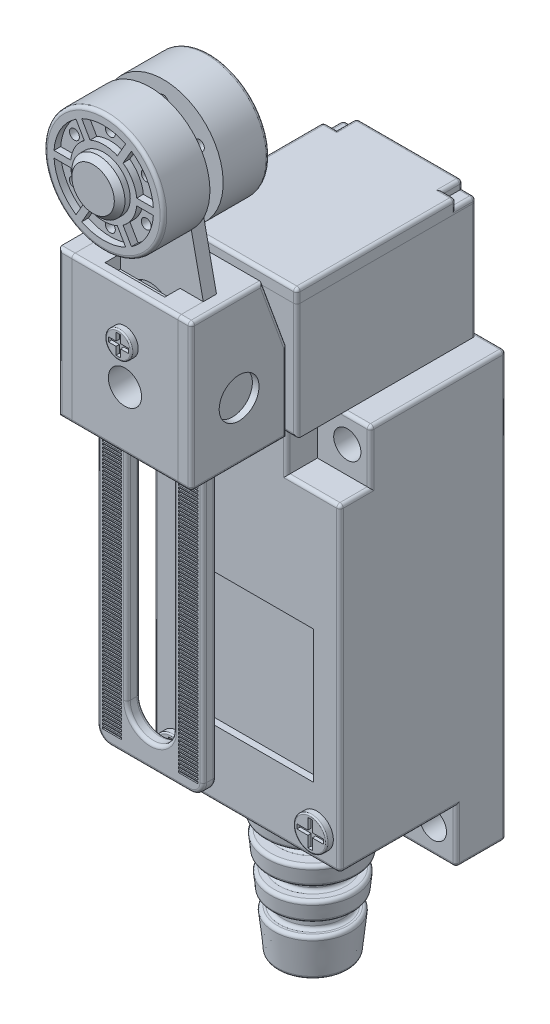
from build123d import *

# Parameters (mm, degrees)
EXTRUDE_1_DEPTH          = 12.5
SKETCH_2_W               = 17.5
SKETCH_2_H               = 8
CUT_EXTRUDE_1_DEPTH      = 67.936537108
SKETCH_3_W               = 4.6
SKETCH_3_H               = 8
CUT_EXTRUDE_2_DEPTH      = 8
SKETCH_4_R               = 2.05
CUT_EXTRUDE_3_DEPTH      = 65.439196146
SKETCH_5_R               = 7.55
EXTRUDE_3_DEPTH          = 22
EXTRUDE_3_TAPER          = 6
SKETCH_6_W               = 3
SKETCH_6_H               = 2
SKETCH_6_W_2             = 2
SKETCH_7_R               = 2.5
EXTRUDE_4_DEPTH          = 1
CUT_EXTRUDE_4_DEPTH      = 0.5
FILLET_1_R               = 0.5
FILLET_3_R               = 0.5
SKETCH_9_W               = 20
SKETCH_9_H               = 20
CUT_EXTRUDE_5_DEPTH      = 1
SKETCH_10_W              = 27
SKETCH_10_H              = 19.5
EXTRUDE_5_DEPTH          = 10
SKETCH_11_R              = 3
EXTRUDE_6_DEPTH          = 15.9
EXTRUDE_7_DEPTH          = 43
EXTRUDE_7_DEPTH_BACK     = 43
SKETCH_12_W              = 16
SKETCH_12_H              = 2
CUT_EXTRUDE_6_DEPTH      = 2
SKETCH_16_W              = 9
SKETCH_16_H              = 2.3
CUT_EXTRUDE_7_DEPTH      = 2
SKETCH_17_R              = 9
EXTRUDE_8_DEPTH          = 7
SKETCH_18_R              = 7.5
SKETCH_18_R_2            = 5
CUT_EXTRUDE_8_DEPTH      = 1
SKETCH_19_R              = 0.75
CUT_EXTRUDE_11_DEPTH     = 6
SKETCH_20_W              = 3.5
SKETCH_20_H              = 1
EXTRUDE_9_DEPTH          = 1
PATTERN_CIRCULAR_1_COUNT = 6
SKETCH_26_R              = 0.75
CUT_EXTRUDE_15_DEPTH     = 6
SKETCH_27_W              = 3.5
SKETCH_27_H              = 1
EXTRUDE_12_DEPTH         = 1
PATTERN_CIRCULAR_3_COUNT = 6
EXTRUDE_10_DEPTH         = 1.6
EXTRUDE_10_DEPTH_BACK    = 17.6
SKETCH_21_R              = 4
SKETCH_22_R              = 2.5
CUT_EXTRUDE_12_DEPTH     = 3.8
SKETCH_23_R              = 2
EXTRUDE_11_DEPTH         = 1
CUT_EXTRUDE_13_DEPTH     = 0.5
SKETCH_25_R              = 3
CUT_EXTRUDE_14_DEPTH     = 1
SKETCH_30_W              = 3
SKETCH_30_H              = 1.25
CUT_EXTRUDE_16_DEPTH     = 2
FILLET_5_R               = 0.5
FILLET_6_R               = 2
FILLET_7_R               = 0.2
CHAMFER_1_SIZE           = 0.8
SKETCH_31_W              = 2.9
SKETCH_31_H              = 0.3
CUT_EXTRUDE_17_DEPTH     = 0.2
PATTERN_LINEAR_1_COUNT   = 82
PATTERN_LINEAR_1_PITCH   = 0.5


with BuildPart() as part:
    # 草图1 → 凸台-拉伸1 (new, symmetric)
    with BuildSketch(Plane.XY):
        Polygon((10, 4.5), (14, 4.5), (14, -59.5), (-14, -59.5), (-14, 4.5), (-10, 4.5), align=None)
    extrude(amount=EXTRUDE_1_DEPTH, both=True)

    # 草图2 → 切除-拉伸1 (cut, through all)
    with BuildSketch(Plane(origin=(14, 0, 0), x_dir=(0, 0, -1), z_dir=(1, 0, 0))):
        with Locations((-3.75, -55.5)):
            Rectangle(SKETCH_2_W, SKETCH_2_H)
    extrude(amount=-CUT_EXTRUDE_1_DEPTH, mode=Mode.SUBTRACT)

    # 草图3 → 切除-拉伸2 (cut)
    with BuildSketch(Plane(origin=(14, 0, 0), x_dir=(0, 0, -1), z_dir=(1, 0, 0))):
        with Locations((-10.2, 0.5)):
            Rectangle(SKETCH_3_W, SKETCH_3_H)
    cut_extrude_2 = extrude(amount=-CUT_EXTRUDE_2_DEPTH, mode=Mode.SUBTRACT)

    # 镜向1: 切除-拉伸2 across plane
    add(cut_extrude_2.mirror(Plane(origin=(0, 0, 0), x_dir=(0, 0, 1), z_dir=(1, 0, 0))), mode=Mode.SUBTRACT)

    # 草图4 → 切除-拉伸3 (cut, through all)
    with BuildSketch(Plane.XY.offset(7.9)):
        with Locations((-10.5, 0.531373033)):
            Circle(SKETCH_4_R)
        with Locations((-10.5, -55.468626967)):
            Circle(SKETCH_4_R)
    cut_extrude_3 = extrude(amount=-CUT_EXTRUDE_3_DEPTH, mode=Mode.SUBTRACT)

    # 镜向2: 切除-拉伸3 across plane
    add(cut_extrude_3.mirror(Plane(origin=(0, 0, 0), x_dir=(0, 0, 1), z_dir=(1, 0, 0))), mode=Mode.SUBTRACT)

    # 草图5 → 凸台-拉伸3 (add)
    with BuildSketch(Plane.XZ.offset(51.5)):
        with Locations((0, 2.6)):
            Circle(SKETCH_5_R)
    extrude(amount=EXTRUDE_3_DEPTH, taper=EXTRUDE_3_TAPER)

    # 草图6 → 切除-旋转1 (revolve, cut)
    with BuildSketch(Plane(origin=(0, 0, 2.6), x_dir=(-1, 0, 0), z_dir=(0, 0, -1)), mode=Mode.PRIVATE) as cut_revolve_1_sk:
        with Locations((-6, -56.5)):
            Rectangle(SKETCH_6_W, SKETCH_6_H)
        with Locations((-6, -61.5)):
            Rectangle(SKETCH_6_W, SKETCH_6_H)
        with Locations((-5.5, -66.5)):
            Rectangle(SKETCH_6_W_2, SKETCH_6_H)
    revolve(cut_revolve_1_sk.sketch.rotate(Axis((0, -51.5, 2.6), (0, -1, 0)), 180), axis=Axis((0, -51.5, 2.6), (0, -1, 0)), mode=Mode.SUBTRACT)

    # 草图7 → 凸台-拉伸4 (add)
    with BuildSketch(Plane.XY.offset(12.5)):
        with Locations(Location((-10.5, -47.5, 0), (0, 0, 180))):
            Circle(SKETCH_7_R)
        with Locations(Location((10.5, -47.5, 0), (0, 0, 180))):
            Circle(SKETCH_7_R)
        with Locations(Location((0, 0.5, 0), (0, 0, 180))):
            Circle(SKETCH_7_R)
    extrude(amount=EXTRUDE_4_DEPTH)

    # 草图8 → 切除-拉伸4 (cut)
    with BuildSketch(Plane.XY.offset(13.5)):
        Polygon((-2, 0.84), (-2, 0.16), (-0.325, 0.16), (-0.325, -1.5), (0.325, -1.5), (0.325, 0.16), (2, 0.16), (2, 0.84), (0.325, 0.84), (0.325, 2.5), (-0.325, 2.5), (-0.325, 0.84), align=None)
        Polygon((-12.5, -47.16), (-12.5, -47.84), (-10.84, -47.84), (-10.84, -49.5), (-10.16, -49.5), (-10.16, -47.84), (-8.5, -47.84), (-8.5, -47.16), (-10.16, -47.16), (-10.16, -45.5), (-10.84, -45.5), (-10.84, -47.16), align=None)
        Polygon((10.84, -47.84), (12.5, -47.84), (12.5, -47.16), (10.84, -47.16), (10.84, -45.5), (10.16, -45.5), (10.16, -47.16), (8.5, -47.16), (8.5, -47.84), (10.16, -47.84), (10.16, -49.5), (10.84, -49.5), align=None)
    extrude(amount=-CUT_EXTRUDE_4_DEPTH, mode=Mode.SUBTRACT)

    # 圆角1
    fillet_1_edges = [part.edges().sort_by_distance(p)[0] for p in [
        (14, -27.5, 12.5),
        (14, -59.5, -8.75),
        (-14, -59.5, -8.75),
        (0, -59.5, -5),
        (-14, -51.5, 3.75),
        (0, -51.5, 12.5),
        (-14, -55.5, -5),
        (14, -55.5, -5),
        (14, -51.5, 3.75),
        (0, 4.5, 12.5),
        (14, 4.5, -2.3),
        (6, 0.5, 12.5),
        (10, -3.5, 12.5),
        (6, 4.5, 10.2),
        (10, 4.5, 7.9),
        (14, -3.5, 10.2),
        (14, 0.5, 7.9),
        (-14, -27.5, 12.5),
        (-14, 4.5, -2.3),
        (-14, -3.5, 10.2),
        (-10, -3.5, 12.5),
        (-14, 0.5, 7.9),
        (-10, 4.5, 7.9),
        (-6, 0.5, 12.5),
        (-6, 4.5, 10.2),
        (0, 4.5, -12.5),
        (14, -27.5, -12.5),
        (0, -59.5, -12.5),
        (-14, -27.5, -12.5),
    ]]
    fillet(fillet_1_edges, radius=FILLET_1_R)

    # 圆角3
    fillet_3_edges = [part.edges().sort_by_distance(p)[0] for p in [
        (-5.237706824, -73.5, 2.6),
        (4.5, -57.5, 2.6),
        (-6.919374588, -57.5, 2.6),
        (-7.129583059, -55.5, 2.6),
        (4.5, -55.5, 2.6),
        (4.5, -62.5, 2.6),
        (-6.393853412, -62.5, 2.6),
        (-6.604061883, -60.5, 2.6),
        (4.5, -60.5, 2.6),
        (4.5, -67.5, 2.6),
        (-5.868332236, -67.5, 2.6),
        (-6.078540706, -65.5, 2.6),
        (4.5, -65.5, 2.6),
    ]]
    fillet(fillet_3_edges, radius=FILLET_3_R)

    # 草图9 → 切除-拉伸5 (cut)
    with BuildSketch(Plane.XY.offset(12.5)):
        with Locations((0, -31.5)):
            Rectangle(SKETCH_9_W, SKETCH_9_H)
    extrude(amount=-CUT_EXTRUDE_5_DEPTH, mode=Mode.SUBTRACT)

    # 草图10 → 凸台-拉伸5 (add, symmetric)
    with BuildSketch(Plane(origin=(0, 0, 0), x_dir=(0, 0, -1), z_dir=(1, 0, 0))):
        with Locations((-1.5, 14.25)):
            Rectangle(SKETCH_10_W, SKETCH_10_H)
        Polygon((-16.5, 5.5), (-30.9, 5.5), (-30.9, 27.5), (-20.139702343, 27.5), (-16.5, 17.5), align=None)
    extrude(amount=EXTRUDE_5_DEPTH, both=True)


with BuildPart() as extrude_5_piece_1:
    # of the separate pieces the step leaves, piece 1, a body of its own (extrude_5_pieces)
    add(part.part.solids().sort_by_distance((7.176641984, -55.052264232, 2.6))[0])



with BuildPart() as extrude_5_piece_2:
    # of the separate pieces the step leaves, piece 2, a body of its own (extrude_5_pieces)
    add(part.part.solids().sort_by_distance((-10, 5.5, 16.5))[0])


with BuildPart() as extrude_5_piece_1_1:
    add(extrude_5_piece_1.part)

    add(extrude_5_piece_2.part)  # 凸台-拉伸6 merges 凸台-拉伸5 piece 2
    # 草图11 → 凸台-拉伸6 (add)
    with BuildSketch(Plane.XY.offset(30.9)):
        with Locations((0, 14.25)):
            Circle(SKETCH_11_R)
    extrude(amount=-EXTRUDE_6_DEPTH)

    # 草图12 → 凸台-拉伸7 (add, two sides: drawn at the far end of the back side and taken through both)
    with BuildSketch(Plane.XZ.offset(-5.5).offset(-EXTRUDE_7_DEPTH_BACK)):
        with Locations((0, 26.1)):
            Rectangle(SKETCH_12_W, SKETCH_12_H)
    extrude(amount=EXTRUDE_7_DEPTH + EXTRUDE_7_DEPTH_BACK)

    # 草图13 → 切除-拉伸6 (cut)
    with BuildSketch(Plane.XY.offset(27.1)):
        with BuildLine():
            Line((3.5, 22.5), (3.5, -30.5))
            ThreePointArc((3.5, -30.5), (0, -34), (-3.5, -30.5))
            Line((-3.5, -30.5), (-3.5, 22.5))
            ThreePointArc((-3.5, 22.5), (0, 26), (3.5, 22.5))
        make_face()
        with BuildLine():
            Line((-8, 27.5), (-4.528302411, 43.83305301))
            ThreePointArc((-4.528302411, 43.83305301), (0, 47.5), (4.528302411, 43.83305301))
            Line((4.528302411, 43.83305301), (8, 27.5))
            Line((8, 27.5), (8, 48.5))
            Line((8, 48.5), (-8, 48.5))
            Line((-8, 48.5), (-8, 27.5))
        make_face()
    extrude(amount=-CUT_EXTRUDE_6_DEPTH, mode=Mode.SUBTRACT)

    # 草图16 → 切除-拉伸7 (cut)
    with BuildSketch(Plane.XZ.offset(-5.5)):
        with Locations((0, 28.25)):
            Rectangle(SKETCH_16_W, SKETCH_16_H)
    cut_extrude_7 = extrude(amount=-CUT_EXTRUDE_7_DEPTH, mode=Mode.SUBTRACT)

    # 草图17 → 凸台-拉伸8 (add)
    with BuildSketch(Plane.XY.offset(27.1)):
        with Locations(Location((0, 42.5, 0), (0, 0, 226.469992278))):
            Circle(SKETCH_17_R)
    extrude_8 = extrude(amount=EXTRUDE_8_DEPTH)

    # 镜向4: 切除-拉伸7 across plane
    add(cut_extrude_7.mirror(Plane.ZX.offset(16.5)), mode=Mode.SUBTRACT)

    # 草图18 → 切除-拉伸8 (cut)
    with BuildSketch(Plane.XY.offset(34.1)):
        with Locations((0, 42.5)):
            Circle(SKETCH_18_R)
        with Locations((0, 42.5)):
            Circle(SKETCH_18_R_2, mode=Mode.SUBTRACT)
    cut_extrude_8 = extrude(amount=-CUT_EXTRUDE_8_DEPTH, mode=Mode.SUBTRACT)

    # 草图19 → 切除-拉伸11 (cut)
    with BuildSketch(Plane.XY.offset(33.1)):
        with Locations((0, 48.75)):
            Circle(SKETCH_19_R)
    cut_extrude_11 = extrude(amount=-CUT_EXTRUDE_11_DEPTH, mode=Mode.SUBTRACT)

    # 草图20 → 凸台-拉伸9 (add)
    with BuildSketch(Plane.XY.offset(33.1)):
        with Locations((6.25, 42.5)):
            Rectangle(SKETCH_20_W, SKETCH_20_H)
    extrude_9 = extrude(amount=EXTRUDE_9_DEPTH)

    # 阵列(圆周)1: 切除-拉伸11, 凸台-拉伸9 ×6 about axis
    pattern_circular_1_axis = Axis((0, 42.5, 0), (0, 0, 1))
    add([cut_extrude_11.rotate(pattern_circular_1_axis, i * 360 / PATTERN_CIRCULAR_1_COUNT) for i in range(1, PATTERN_CIRCULAR_1_COUNT)], mode=Mode.SUBTRACT)
    add([extrude_9.rotate(pattern_circular_1_axis, i * 360 / PATTERN_CIRCULAR_1_COUNT) for i in range(1, PATTERN_CIRCULAR_1_COUNT)])

    # 镜向6: 凸台-拉伸8, 切除-拉伸8 across plane
    add(extrude_8.mirror(Plane(origin=(0, 0, 26.1), x_dir=(1, 0, 0), z_dir=(0, 0, -1))))
    add(cut_extrude_8.mirror(Plane(origin=(0, 0, 26.1), x_dir=(1, 0, 0), z_dir=(0, 0, -1))), mode=Mode.SUBTRACT)

    # 草图26 → 切除-拉伸15 (cut)
    with BuildSketch(Plane(origin=(0, 0, 19.1), x_dir=(-1, 0, 0), z_dir=(0, 0, -1))):
        with Locations(Location((0, 48.75, 0), (0, 0, 180))):
            Circle(SKETCH_26_R)
    cut_extrude_15 = extrude(amount=-CUT_EXTRUDE_15_DEPTH, mode=Mode.SUBTRACT)

    # 草图27 → 凸台-拉伸12 (add)
    with BuildSketch(Plane(origin=(0, 0, 19.1), x_dir=(-1, 0, 0), z_dir=(0, 0, -1))):
        with Locations((6.25, 42.5)):
            Rectangle(SKETCH_27_W, SKETCH_27_H)
    extrude_12 = extrude(amount=EXTRUDE_12_DEPTH)

    # 阵列(圆周)3: 切除-拉伸15, 凸台-拉伸12 ×6 about axis
    pattern_circular_3_axis = Axis((0, 42.5, 0), (0, 0, 1))
    add([cut_extrude_15.rotate(pattern_circular_3_axis, i * 360 / PATTERN_CIRCULAR_3_COUNT) for i in range(1, PATTERN_CIRCULAR_3_COUNT)], mode=Mode.SUBTRACT)
    add([extrude_12.rotate(pattern_circular_3_axis, i * 360 / PATTERN_CIRCULAR_3_COUNT) for i in range(1, PATTERN_CIRCULAR_3_COUNT)])

    # 草图21 → 凸台-拉伸10 (add, two sides: drawn at the far end of the back side and taken through both)
    with BuildSketch(Plane.XY.offset(34.1).offset(-EXTRUDE_10_DEPTH_BACK)):
        with Locations(Location((0, 42.5, 0), (0, 0, 180))):
            Circle(SKETCH_21_R)
    extrude(amount=EXTRUDE_10_DEPTH + EXTRUDE_10_DEPTH_BACK)

    # 草图22 → 切除-拉伸12 (cut)
    with BuildSketch(Plane.XY.offset(30.9)):
        with Locations((0, 14.25)):
            Circle(SKETCH_22_R)
    extrude(amount=-CUT_EXTRUDE_12_DEPTH, mode=Mode.SUBTRACT)

    # 草图23 → 凸台-拉伸11 (add)
    with BuildSketch(Plane.XY.offset(30.9)):
        with Locations((0, 20.25)):
            Circle(SKETCH_23_R)
    extrude(amount=EXTRUDE_11_DEPTH)

    # 草图24 → 切除-拉伸13 (cut)
    with BuildSketch(Plane.XY.offset(31.9)):
        Polygon((0.34, 20.59), (1.5, 20.59), (1.5, 19.91), (0.34, 19.91), (0.34, 18.75), (-0.34, 18.75), (-0.34, 19.91), (-1.5, 19.91), (-1.5, 20.59), (-0.34, 20.59), (-0.34, 21.75), (0.34, 21.75), align=None)
    extrude(amount=-CUT_EXTRUDE_13_DEPTH, mode=Mode.SUBTRACT)

    # 草图25 → 切除-拉伸14 (cut)
    with BuildSketch(Plane(origin=(10, 0, 0), x_dir=(0, 0, -1), z_dir=(1, 0, 0))):
        with Locations((-23.7, 14.25)):
            Circle(SKETCH_25_R)
    extrude(amount=-CUT_EXTRUDE_14_DEPTH, mode=Mode.SUBTRACT)

    # 草图30 → 切除-拉伸16 (cut)
    with BuildSketch(Plane(origin=(10, 0, 0), x_dir=(0, 0, -1), z_dir=(1, 0, 0))):
        with Locations((10.5, 23.375)):
            Rectangle(SKETCH_30_W, SKETCH_30_H)
    cut_extrude_16 = extrude(amount=-CUT_EXTRUDE_16_DEPTH, mode=Mode.SUBTRACT)

    # 镜向7: 切除-拉伸16 across plane
    add(cut_extrude_16.mirror(Plane(origin=(0, 0, 0), x_dir=(0, 0, 1), z_dir=(1, 0, 0))), mode=Mode.SUBTRACT)

    # 圆角5
    fillet_5_edges = [extrude_5_piece_1_1.edges().sort_by_distance(p)[0] for p in [
        (-10, 13.625, -12),
        (-10, 14.25, 15),
        (0, 24, 15),
        (0, 4.5, 15),
        (10, 13.625, -12),
        (10, 14.25, 15),
        (-10, 11.5, 16.5),
        (-10, 22.5, 18.319851171),
        (-10, 16.5, 30.9),
        (0, 27.5, 30.9),
        (0, 5.5, 30.9),
        (10, 11.5, 16.5),
        (10, 22.5, 18.319851171),
        (10, 27.5, 25.519851171),
        (10, 16.5, 30.9),
        (10, 5.5, 23.7),
        (-8, -16, 27.1),
        (-8, -16, 25.1),
        (8, -16, 25.1),
        (8, -16, 27.1),
        (0, -37.5, 25.1),
        (0, -37.5, 27.1),
        (3.5, -12.5, 25.1),
        (3.5, -11.5, 27.1),
        (-3.5, -11.5, 27.1),
        (0, -34, 27.1),
        (-3.5, -12.5, 25.1),
        (0, -34, 25.1),
        (0, 5.5, 30.9),
        (0, 27.5, 30.9),
        (0, 5.5, 30.9),
        (0, 27.5, 30.9),
        (-4.5, 6.5, 29.4),
        (4.5, 6.5, 29.4),
        (-4.5, 5.5, 28.25),
        (4.5, 5.5, 28.25),
        (0, 5.5, 29.4),
        (6.198609457, 49.025123814, 34.1),
        (6.198609457, 49.025123814, 18.1),
        (10, 13.625, -12),
        (10, 14.25, 15),
        (-10, 13.625, -12),
        (-10, 14.25, 15),
        (10, 24, 3),
        (0, 24, -12),
        (8, 23.375, -12),
        (9, 22.75, -12),
        (8, 24, -10.5),
        (9, 24, -9),
        (10, 23.375, -9),
        (10, 22.75, -10.5),
        (-10, 24, 3),
        (-9, 22.75, -12),
        (-10, 23.375, -9),
        (-9, 24, -9),
        (-10, 22.75, -10.5),
        (-8, 23.375, -12),
        (-8, 24, -10.5),
    ]]
    fillet(fillet_5_edges, radius=FILLET_5_R)

    # 圆角6
    # the kernel refuses this fillet: 2 mm, written as the material it takes off along each edge
    with BuildSketch(Plane(origin=(-6, -35.5, 27.1), x_dir=(-1, 0, 0), z_dir=(0, 1, 0))) as fillet_6_piece_1:
        with BuildLine():
            CenterArc((1.5, -0.5), 0.5, 0, 90)
            Line((2, -0.5), (2, 0))
            Line((2, 0), (1.5, 0))
        make_face()
    revolve(axis=Axis((-6, -35.5, 27.1), (0, 0, 1)), revolution_arc=90, mode=Mode.SUBTRACT)
    with BuildSketch(Plane(origin=(6, -35.5, 27.1), x_dir=(0, -1, 0), z_dir=(-1, 0, 0))) as fillet_6_piece_2:
        with BuildLine():
            CenterArc((1.5, -0.5), 0.5, 0, 90)
            Line((2, -0.5), (2, 0))
            Line((2, 0), (1.5, 0))
        make_face()
    revolve(axis=Axis((6, -35.5, 27.1), (0, 0, 1)), revolution_arc=90, mode=Mode.SUBTRACT)
    with BuildSketch(Plane(origin=(-6, -35.5, 25.1), x_dir=(0, -1, 0), z_dir=(1, 0, 0))) as fillet_6_piece_3:
        with BuildLine():
            CenterArc((1.5, -0.5), 0.5, 0, 90)
            Line((2, -0.5), (2, 0))
            Line((2, 0), (1.5, 0))
        make_face()
    revolve(axis=Axis((-6, -35.5, 25.1), (0, 0, -1)), revolution_arc=90, mode=Mode.SUBTRACT)
    with BuildSketch(Plane(origin=(6, -35.5, 25.1), x_dir=(1, 0, 0), z_dir=(0, 1, 0))) as fillet_6_piece_4:
        with BuildLine():
            CenterArc((1.5, -0.5), 0.5, 0, 90)
            Line((2, -0.5), (2, 0))
            Line((2, 0), (1.5, 0))
        make_face()
    revolve(axis=Axis((6, -35.5, 25.1), (0, 0, -1)), revolution_arc=90, mode=Mode.SUBTRACT)
    with BuildSketch(Plane(origin=(8, -37.5, 27.1), x_dir=(-1, 0, 0), z_dir=(0, 0, -1)), Plane(origin=(-8, -37.5, 25.1), x_dir=(1, 0, 0), z_dir=(0, 0, 1))) as fillet_6_piece_5:
        with BuildLine():
            CenterArc((FILLET_6_R, FILLET_6_R), FILLET_6_R, 180, 90)
            Line((0, FILLET_6_R), (0, 0))
            Line((0, 0), (FILLET_6_R, 0))
        make_face()
    extrude(amount=2, mode=Mode.SUBTRACT)

    # 圆角7
    fillet_7_edges = [extrude_5_piece_1_1.edges().sort_by_distance(p)[0] for p in [
        (-8, -47.5, 13.5),
        (13, -47.5, 13.5),
        (2.5, 0.5, 13.5),
        (-2, 20.25, 31.9),
    ]]
    fillet(fillet_7_edges, radius=FILLET_7_R)

    # 倒角1
    chamfer_1_edges = [extrude_5_piece_1_1.edges().sort_by_distance(p)[0] for p in [
        (4, 42.5, 16.5),
        (4, 42.5, 35.7),
    ]]
    chamfer(chamfer_1_edges, length=CHAMFER_1_SIZE)

    # 草图31 → 切除-拉伸17 (cut)
    with BuildSketch(Plane.XY.offset(27.1)):
        with Locations((5.75, 4.85)):
            Rectangle(SKETCH_31_W, SKETCH_31_H)
        with Locations((-5.75, 4.85)):
            Rectangle(SKETCH_31_W, SKETCH_31_H)
    cut_extrude_17 = extrude(amount=-CUT_EXTRUDE_17_DEPTH, mode=Mode.SUBTRACT)

    # 阵列(线性)1: 切除-拉伸17 ×82
    with Locations(*[(0, -i * PATTERN_LINEAR_1_PITCH, 0) for i in range(1, PATTERN_LINEAR_1_COUNT)]):
        add(cut_extrude_17, mode=Mode.SUBTRACT)


solid = extrude_5_piece_1_1.part
